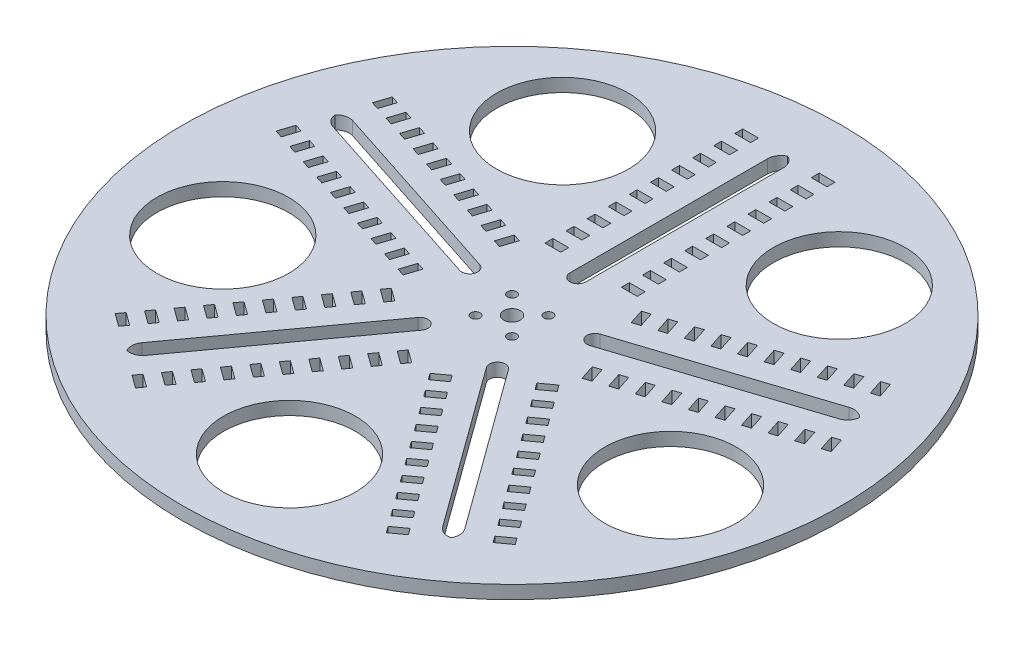
from build123d import *

# Parameters (mm, degrees)
CROQUIS1_R              = 125
SALIENTE_EXTRUIR1_DEPTH = 5
CROQUIS2_R              = 3.15
CORTAR_EXTRUIR1_DEPTH   = 177.847391838
CORTAR_EXTRUIR2_DEPTH   = 177.847391838
CROQUIS5_W              = 6
CROQUIS5_H              = 3
CORTAR_EXTRUIR3_DEPTH   = 177.847391838
CROQUIS7_R              = 25
CORTAR_EXTRUIR4_DEPTH   = 10
REDONDEO1_R             = 5
CORTAR_EXTRUIR5_DEPTH   = 177.847391838
CROQUIS9_W              = 6
CROQUIS9_H              = 3
CORTAR_EXTRUIR6_DEPTH   = 177.847391838


with BuildPart() as part:
    # Croquis1 → Saliente-Extruir1 (new body)
    with BuildSketch(Plane(origin=(0, 0, 0), x_dir=(1, 0, 0), z_dir=(0, 1, 0))):
        with Locations(Location((0, 0, 0), (0, 0, 270))):
            Circle(CROQUIS1_R)
    extrude(amount=SALIENTE_EXTRUIR1_DEPTH)

    # Croquis2 → Cortar-Extruir1 (cut, through all)
    with BuildSketch(Plane(origin=(0, 5, 0), x_dir=(1, 0, 0), z_dir=(0, 1, 0))):
        with Locations(Location((0, 0, 0), (0, 0, 270))):
            Circle(CROQUIS2_R)
    extrude(amount=-CORTAR_EXTRUIR1_DEPTH, mode=Mode.SUBTRACT)

    # Croquis3 → Cortar-Extruir2 (cut, through all)
    with BuildSketch(Plane(origin=(0, 5, 0), x_dir=(1, 0, 0), z_dir=(0, 1, 0))):
        with BuildLine():
            Line((3, 25), (3, 104.957134107))
            ThreePointArc((3, 104.957134107), (0, 105), (-3, 104.957134107))
            Line((-3, 104.957134107), (-3, 25))
            ThreePointArc((-3, 25), (0, 22), (3, 25))
        make_face()
        with BuildLine():
            ThreePointArc((100.747217307, 29.580368571), (99.860934211, 32.446784409), (98.893115341, 35.286707669))
            Line((98.893115341, 35.286707669), (22.849361924, 10.578594408))
            ThreePointArc((22.849361924, 10.578594408), (20.923243358, 6.798373876), (24.703463891, 4.87225531))
            Line((24.703463891, 4.87225531), (100.747217307, 29.580368571))
        make_face()
        with BuildLine():
            ThreePointArc((59.265204568, -86.675460931), (61.717451491, -84.946784409), (64.119306534, -83.148749417))
            Line((64.119306534, -83.148749417), (17.12168229, -18.462069102))
            ThreePointArc((17.12168229, -18.462069102), (12.93127555, -17.798373876), (12.267580324, -21.988780616))
            Line((12.267580324, -21.988780616), (59.265204568, -86.675460931))
        make_face()
        with BuildLine():
            Line((-17.12168229, -18.462069102), (-64.119306534, -83.148749417))
            ThreePointArc((-64.119306534, -83.148749417), (-61.717451491, -84.946784409), (-59.265204568, -86.675460931))
            Line((-59.265204568, -86.675460931), (-12.267580324, -21.988780616))
            ThreePointArc((-12.267580324, -21.988780616), (-12.93127555, -17.798373876), (-17.12168229, -18.462069102))
        make_face()
        with BuildLine():
            Line((-22.849361924, 10.578594408), (-98.893115341, 35.286707669))
            ThreePointArc((-98.893115341, 35.286707669), (-99.860934211, 32.446784409), (-100.747217307, 29.580368571))
            Line((-100.747217307, 29.580368571), (-24.703463891, 4.87225531))
            ThreePointArc((-24.703463891, 4.87225531), (-20.923243358, 6.798373876), (-22.849361924, 10.578594408))
        make_face()
    extrude(amount=-CORTAR_EXTRUIR2_DEPTH, mode=Mode.SUBTRACT)

    # Croquis5 → Cortar-Extruir3 (cut, through all)
    with BuildSketch(Plane(origin=(0, 5, 0), x_dir=(1, 0, 0), z_dir=(0, 1, 0))):
        Polygon((91.599967261, 48.163222461), (93.454069227, 42.456883364), (96.307238776, 43.383934347), (94.453136809, 49.090273445), align=None)
        with Locations((-14.5, 103.5)):
            Rectangle(CROQUIS5_W, CROQUIS5_H)
        with Locations((14.5, 103.5)):
            Rectangle(CROQUIS5_W, CROQUIS5_H)
        Polygon((100.561460097, 20.582583489), (102.415562064, 14.876244391), (105.268731613, 15.803295374), (103.414629646, 21.509634472), align=None)
        Polygon((74.111893135, -72.233491511), (69.257791169, -75.760203025), (71.021146926, -78.187254008), (75.875248892, -74.660542494), align=None)
        Polygon((50.650400299, -89.279263828), (45.796298332, -92.805975341), (47.559654089, -95.233026324), (52.413756055, -91.706314811), align=None)
        Polygon((-45.796298332, -92.805975341), (-50.650400298, -89.279263828), (-52.413756055, -91.706314811), (-47.559654089, -95.233026325), align=None)
        Polygon((-69.257791169, -75.760203025), (-74.111893135, -72.233491511), (-75.875248892, -74.660542494), (-71.021146926, -78.187254008), align=None)
        Polygon((-102.415562064, 14.876244391), (-100.561460097, 20.582583489), (-103.414629646, 21.509634472), (-105.268731613, 15.803295374), align=None)
        Polygon((-93.454069227, 42.456883364), (-91.599967261, 48.163222461), (-94.453136809, 49.090273445), (-96.307238776, 43.383934347), align=None)
    extrude(amount=-CORTAR_EXTRUIR3_DEPTH, mode=Mode.SUBTRACT)

    # Croquis7 → Cortar-Extruir4 (cut)
    with BuildSketch(Plane(origin=(0, 5, 0), x_dir=(1, 0, 0), z_dir=(0, 1, 0))):
        with Locations(Location((-50.946557671, 70.121920888, 0), (0, 0, 270))):
            Circle(CROQUIS7_R)
        with Locations(Location((52.237827472, 71.899201297, 0), (0, 0, 270))):
            Circle(CROQUIS7_R)
        with Locations(Location((85.813850149, -25.685770723, 0), (0, 0, 270))):
            Circle(CROQUIS7_R)
        with Locations(Location((3.380588228, -87.773880631, 0), (0, 0, 270))):
            Circle(CROQUIS7_R)
        with Locations(Location((-81.14199212, -28.561470832, 0), (0, 0, 270))):
            Circle(CROQUIS7_R)
    extrude(amount=-CORTAR_EXTRUIR4_DEPTH, mode=Mode.SUBTRACT)

    # Redondeo1
    # the kernel refuses this fillet: 5 mm, written as the material it adds along each edge
    with BuildSketch(Plane(origin=(-98.893115341, 5, -35.286707669), x_dir=(-0.31309131381965727, 0, 0.9497230276299932), z_dir=(0, -1, 0)), Plane(origin=(-64.119306534, 5, 83.148749417), x_dir=(0.8064897373416208, 0, 0.5912480896904814), z_dir=(0, -1, 0)), Plane(origin=(59.265204568, 5, 86.675460931), x_dir=(0.8115293830747445, 0, -0.5843116124178303), z_dir=(0, -1, 0)), Plane(origin=(100.747217307, 5, -29.580368571), x_dir=(-0.30493699573220334, 0, -0.9523725261859552), z_dir=(0, -1, 0)), Plane(origin=(3, 5, -104.957134107), x_dir=(-0.9999908108645211, 0, -0.004286978716716978), z_dir=(0, -1, 0))) as redondeo1_piece_1:
        with BuildLine():
            CenterArc((4.978617178, -4.998525266), REDONDEO1_R, 88.608381462, 91.145991998)
            Line((-0.021336877, -4.977090372), (0, 0))
            ThreePointArc((0, 0), (2.550023433, 0.030969422), (5.100046865, 0))
        make_face()
    extrude(amount=5)
    with BuildSketch(Plane(origin=(-100.747217307, 5, -29.580368571), x_dir=(0.9510565162951053, 0, 0.30901699437509594), z_dir=(0, -1, 0)), Plane(origin=(64.119306534, 5, 83.148749417), x_dir=(-0.5877852522923023, 0, -0.8090169943750716), z_dir=(0, -1, 0))) as redondeo1_piece_2:
        with BuildLine():
            CenterArc((4.977136108, -5), REDONDEO1_R, 90, 91.145991998)
            ThreePointArc((-0.021863792, -5.1), (-0.041901034, -2.549867235), (0, 0))
            Line((0, 0), (4.977136108, 0))
        make_face()
    extrude(amount=5)
    with BuildSketch(Plane(origin=(-59.265204568, 5, 86.675460931), x_dir=(-0.8115293830747364, 0, -0.5843116124178414), z_dir=(0, -1, 0)), Plane(origin=(98.893115341, 5, -35.286707669), x_dir=(0.3130913138196611, 0, 0.949723027629992), z_dir=(0, -1, 0)), Plane(origin=(-3, 5, -104.957134107), x_dir=(0.9999908108645212, 0, -0.004286978716706356), z_dir=(0, -1, 0))) as redondeo1_piece_3:
        with BuildLine():
            CenterArc((4.978617178, 4.998525266), REDONDEO1_R, 180.24562654, 91.145991998)
            Line((-0.021336877, 4.977090372), (0, 0))
            ThreePointArc((0, 0), (2.550023433, -0.030969422), (5.100046865, 0))
        make_face()
    extrude(amount=5)

    # Croquis8 → Cortar-Extruir5 (cut, through all)
    with BuildSketch(Plane(origin=(0, 5, 0), x_dir=(1, 0, 0), z_dir=(0, 1, 0))):
        with BuildLine():
            Line((-6.915, 5.165), (-6.915, 6.915))
            Line((-6.915, 6.915), (-5.165, 6.915))
            ThreePointArc((-5.165, 6.915), (-8.152436867, 8.152436867), (-6.915, 5.165))
        make_face()
        with BuildLine():
            Line((-5.165, 6.915), (-6.915, 6.915))
            Line((-6.915, 6.915), (-6.915, 5.165))
            ThreePointArc((-6.915, 5.165), (-5.677563133, 5.677563133), (-5.165, 6.915))
        make_face()
        with BuildLine():
            ThreePointArc((8.665, 6.915), (6.915, 8.665), (5.165, 6.915))
            Line((5.165, 6.915), (6.915, 6.915))
            Line((6.915, 6.915), (6.915, 5.165))
            ThreePointArc((6.915, 5.165), (8.152436867, 5.677563133), (8.665, 6.915))
        make_face()
        with BuildLine():
            Line((6.915, 6.915), (5.165, 6.915))
            ThreePointArc((5.165, 6.915), (5.677563133, 5.677563133), (6.915, 5.165))
            Line((6.915, 5.165), (6.915, 6.915))
        make_face()
        with BuildLine():
            ThreePointArc((8.665, -6.915), (8.152436867, -5.677563133), (6.915, -5.165))
            Line((6.915, -5.165), (6.915, -6.915))
            Line((6.915, -6.915), (5.165, -6.915))
            ThreePointArc((5.165, -6.915), (6.915, -8.665), (8.665, -6.915))
        make_face()
        with BuildLine():
            Line((6.915, -6.915), (6.915, -5.165))
            ThreePointArc((6.915, -5.165), (5.677563133, -5.677563133), (5.165, -6.915))
            Line((5.165, -6.915), (6.915, -6.915))
        make_face()
        with BuildLine():
            ThreePointArc((-5.165, -6.915), (-5.677563133, -5.677563133), (-6.915, -5.165))
            Line((-6.915, -5.165), (-6.915, -6.915))
            Line((-6.915, -6.915), (-5.165, -6.915))
        make_face()
        with BuildLine():
            Line((-6.915, -6.915), (-6.915, -5.165))
            ThreePointArc((-6.915, -5.165), (-8.152436867, -8.152436867), (-5.165, -6.915))
            Line((-5.165, -6.915), (-6.915, -6.915))
        make_face()
    extrude(amount=-CORTAR_EXTRUIR5_DEPTH, mode=Mode.SUBTRACT)

    # Croquis9 → Cortar-Extruir6 (cut, through all)
    with BuildSketch(Plane(origin=(0, 5, 0), x_dir=(1, 0, 0), z_dir=(0, 1, 0))):
        with Locations((-14.5, 95.5)):
            Rectangle(CROQUIS9_W, CROQUIS9_H)
        with Locations((14.5, 95.5)):
            Rectangle(CROQUIS9_W, CROQUIS9_H)
        with Locations((-14.5, 87.5)):
            Rectangle(CROQUIS9_W, CROQUIS9_H)
        with Locations((14.5, 87.5)):
            Rectangle(CROQUIS9_W, CROQUIS9_H)
        with Locations((-14.5, 79.5)):
            Rectangle(CROQUIS9_W, CROQUIS9_H)
        with Locations((14.5, 79.5)):
            Rectangle(CROQUIS9_W, CROQUIS9_H)
        with Locations((-14.5, 71.5)):
            Rectangle(CROQUIS9_W, CROQUIS9_H)
        with Locations((14.5, 71.5)):
            Rectangle(CROQUIS9_W, CROQUIS9_H)
        with Locations((-14.5, 63.5)):
            Rectangle(CROQUIS9_W, CROQUIS9_H)
        with Locations((14.5, 63.5)):
            Rectangle(CROQUIS9_W, CROQUIS9_H)
        with Locations((-14.5, 55.5)):
            Rectangle(CROQUIS9_W, CROQUIS9_H)
        with Locations((14.5, 55.5)):
            Rectangle(CROQUIS9_W, CROQUIS9_H)
        with Locations((-14.5, 47.5)):
            Rectangle(CROQUIS9_W, CROQUIS9_H)
        with Locations((14.5, 47.5)):
            Rectangle(CROQUIS9_W, CROQUIS9_H)
        with Locations((-14.5, 39.5)):
            Rectangle(CROQUIS9_W, CROQUIS9_H)
        with Locations((14.5, 39.5)):
            Rectangle(CROQUIS9_W, CROQUIS9_H)
        with Locations((-14.5, 31.5)):
            Rectangle(CROQUIS9_W, CROQUIS9_H)
        with Locations((14.5, 31.5)):
            Rectangle(CROQUIS9_W, CROQUIS9_H)
        Polygon((86.844684679, 46.61813749), (88.698786645, 40.911798392), (85.845617096, 39.984747409), (83.99151513, 45.691086506), align=None)
        Polygon((95.806177516, 19.037498517), (92.953007967, 18.110447534), (94.807109933, 12.404108436), (97.660279482, 13.331159419), align=None)
        Polygon((71.172966874, -68.188406539), (66.318864908, -71.715118053), (64.555509151, -69.28806707), (69.409611117, -65.761355556), align=None)
        Polygon((47.711474037, -85.234178856), (45.94811828, -82.807127873), (41.094016314, -86.333839386), (42.857372071, -88.760890369), align=None)
        Polygon((-42.857372071, -88.76089037), (-47.711474037, -85.234178856), (-45.94811828, -82.807127873), (-41.094016314, -86.333839386), align=None)
        Polygon((-66.318864908, -71.715118053), (-64.555509151, -69.28806707), (-69.409611117, -65.761355556), (-71.172966874, -68.188406539), align=None)
        Polygon((-97.660279482, 13.331159419), (-95.806177516, 19.037498517), (-92.953007967, 18.110447534), (-94.807109933, 12.404108436), align=None)
        Polygon((-88.698786645, 40.911798392), (-85.845617096, 39.984747409), (-83.99151513, 45.691086506), (-86.844684679, 46.61813749), align=None)
        Polygon((73.481882385, 35.967526482), (70.628712836, 35.040475499), (68.774610869, 40.746814596), (71.627780418, 41.67386558), align=None)
        Polygon((80.589273255, 14.093226607), (82.443375221, 8.386887509), (79.590205673, 7.459836526), (77.736103706, 13.166175624), align=None)
        Polygon((56.914300871, -58.770846143), (55.150945114, -56.34379516), (60.00504708, -52.817083646), (61.768402837, -55.244134629), align=None)
        Polygon((38.30691, -72.289906946), (33.452808034, -75.816618459), (31.689452277, -73.389567476), (36.543554244, -69.862855963), align=None)
        Polygon((-38.30691, -72.289906946), (-36.543554243, -69.862855963), (-31.689452277, -73.389567476), (-33.452808034, -75.816618459), align=None)
        Polygon((-56.914300871, -58.770846143), (-61.768402837, -55.244134629), (-60.00504708, -52.817083646), (-55.150945114, -56.34379516), align=None)
        Polygon((-80.589273255, 14.093226607), (-77.736103706, 13.166175624), (-79.590205673, 7.459836526), (-82.443375221, 8.386887509), align=None)
        Polygon((-73.481882385, 35.967526482), (-71.627780418, 41.67386558), (-68.774610869, 40.746814596), (-70.628712836, 35.040475499), align=None)
        Polygon((79.236232549, 44.146001535), (81.090334515, 38.439662437), (78.237164966, 37.512611454), (76.383063, 43.218950551), align=None)
        Polygon((88.197725386, 16.565362562), (85.344555837, 15.638311579), (87.198657803, 9.931972481), (90.051827352, 10.859023464), align=None)
        Polygon((66.470684856, -61.716270584), (61.616582889, -65.242982098), (59.853227132, -62.815931115), (64.707329099, -59.289219601), align=None)
        Polygon((43.009192019, -78.762042901), (41.245836262, -76.334991918), (36.391734296, -79.861703431), (38.155090052, -82.288754414), align=None)
        Polygon((-38.155090052, -82.288754414), (-43.009192019, -78.762042901), (-41.245836262, -76.334991918), (-36.391734296, -79.861703431), align=None)
        Polygon((-61.616582889, -65.242982098), (-59.853227132, -62.815931115), (-64.707329099, -59.289219601), (-66.470684856, -61.716270584), align=None)
        Polygon((-90.051827352, 10.859023464), (-88.197725386, 16.565362562), (-85.344555837, 15.638311579), (-87.198657803, 9.931972481), align=None)
        Polygon((-81.090334515, 38.439662437), (-78.237164966, 37.512611454), (-76.383063, 43.218950551), (-79.236232549, 44.146001535), align=None)
        Polygon((64.019328288, 39.201729625), (65.873430254, 33.495390527), (63.020260705, 32.568339544), (61.166158739, 38.274678641), align=None)
        Polygon((72.980821125, 11.621090652), (74.834923091, 5.914751554), (71.981753542, 4.987700571), (70.127651576, 10.694039669), align=None)
        Polygon((57.066120819, -48.771998674), (52.212018853, -52.298710188), (50.448663096, -49.871659205), (55.302765062, -46.344947691), align=None)
        Polygon((33.604627982, -65.817770991), (28.750526016, -69.344482504), (26.987170259, -66.917431521), (31.841272225, -63.390720008), align=None)
        Polygon((-28.750526016, -69.344482504), (-33.604627982, -65.817770991), (-31.841272225, -63.390720008), (-26.987170259, -66.917431521), align=None)
        Polygon((-52.212018853, -52.298710188), (-57.066120819, -48.771998674), (-55.302765062, -46.344947691), (-50.448663096, -49.871659205), align=None)
        Polygon((-74.834923091, 5.914751554), (-72.980821125, 11.621090652), (-70.127651576, 10.694039669), (-71.981753542, 4.987700571), align=None)
        Polygon((-65.873430254, 33.495390527), (-64.019328288, 39.201729625), (-61.166158739, 38.274678641), (-63.020260705, 32.568339544), align=None)
        Polygon((48.802424027, 34.257457715), (50.656525994, 28.551118617), (47.803356445, 27.624067634), (45.949254478, 33.330406731), align=None)
        Polygon((57.763916864, 6.676818742), (54.910747315, 5.749767759), (56.764849282, 0.043428661), (59.61801883, 0.970479644), align=None)
        Polygon((47.661556782, -35.827726764), (42.807454816, -39.354438278), (41.044099059, -36.927387295), (45.898201025, -33.400675781), align=None)
        Polygon((24.200063945, -52.873499081), (22.436708189, -50.446448098), (17.582606222, -53.973159611), (19.345961979, -56.400210594), align=None)
        Polygon((-19.345961979, -56.400210594), (-24.200063945, -52.873499081), (-22.436708188, -50.446448098), (-17.582606222, -53.973159611), align=None)
        Polygon((-42.807454816, -39.354438278), (-41.044099059, -36.927387295), (-45.898201025, -33.400675781), (-47.661556782, -35.827726764), align=None)
        Polygon((-59.61801883, 0.970479644), (-57.763916864, 6.676818742), (-54.910747315, 5.749767759), (-56.764849281, 0.043428661), align=None)
        Polygon((-50.656525994, 28.551118617), (-47.803356445, 27.624067634), (-45.949254478, 33.330406731), (-48.802424027, 34.257457715), align=None)
        Polygon((56.410876158, 36.72959367), (58.264978124, 31.023254572), (55.411808575, 30.096203589), (53.557706609, 35.802542686), align=None)
        Polygon((65.372368995, 9.148954697), (67.226470961, 3.442615599), (64.373301412, 2.515564616), (62.519199446, 8.221903714), align=None)
        Polygon((52.363838801, -42.299862719), (47.509736834, -45.826574233), (45.746381077, -43.39952325), (50.600483044, -39.872811736), align=None)
        Polygon((28.902345964, -59.345635036), (24.048243997, -62.872346549), (22.284888241, -60.445295566), (27.138990207, -56.918584053), align=None)
        Polygon((-24.048243997, -62.872346549), (-28.902345964, -59.345635036), (-27.138990207, -56.918584053), (-22.284888241, -60.445295566), align=None)
        Polygon((-47.509736834, -45.826574233), (-52.363838801, -42.299862719), (-50.600483044, -39.872811736), (-45.746381077, -43.39952325), align=None)
        Polygon((-67.226470961, 3.442615599), (-65.372368994, 9.148954697), (-62.519199446, 8.221903714), (-64.373301412, 2.515564616), align=None)
        Polygon((-58.264978124, 31.023254572), (-56.410876158, 36.72959367), (-53.557706609, 35.802542686), (-55.411808575, 30.096203589), align=None)
        Polygon((33.585519767, 29.313185805), (35.439621733, 23.606846707), (32.586452184, 22.679795724), (30.732350218, 28.386134821), align=None)
        Polygon((42.547012603, 1.732546832), (44.40111457, -3.973792266), (41.547945021, -4.900843249), (39.693843055, 0.805495849), align=None)
        Polygon((38.256992746, -22.883454854), (33.402890779, -26.410166368), (31.639535022, -23.983115385), (36.493636989, -20.456403871), align=None)
        Polygon((14.795499909, -39.929227171), (9.941397942, -43.455938684), (8.178042186, -41.028887701), (13.032144152, -37.502176188), align=None)
        Polygon((-9.941397942, -43.455938684), (-14.795499909, -39.929227171), (-13.032144152, -37.502176188), (-8.178042186, -41.028887701), align=None)
        Polygon((-33.402890779, -26.410166368), (-38.256992746, -22.883454854), (-36.493636989, -20.456403871), (-31.639535022, -23.983115385), align=None)
        Polygon((-44.40111457, -3.973792266), (-42.547012603, 1.732546832), (-39.693843055, 0.805495849), (-41.547945021, -4.900843249), align=None)
        Polygon((-35.439621733, 23.606846707), (-33.585519767, 29.313185805), (-30.732350218, 28.386134821), (-32.586452184, 22.679795724), align=None)
        Polygon((41.193971897, 31.78532176), (43.048073863, 26.078982662), (40.194904314, 25.151931679), (38.340802348, 30.858270776), align=None)
        Polygon((50.155464734, 4.204682787), (52.0095667, -1.501656311), (49.156397151, -2.428707294), (47.302295185, 3.277631804), align=None)
        Polygon((42.959274764, -29.355590809), (38.105172798, -32.882302323), (36.341817041, -30.45525134), (41.195919007, -26.928539826), align=None)
        Polygon((19.497781927, -46.401363126), (14.643679961, -49.928074639), (12.880324204, -47.501023656), (17.73442617, -43.974312143), align=None)
        Polygon((-14.643679961, -49.928074639), (-19.497781927, -46.401363126), (-17.73442617, -43.974312143), (-12.880324204, -47.501023656), align=None)
        Polygon((-38.105172798, -32.882302323), (-42.959274764, -29.355590809), (-41.195919007, -26.928539826), (-36.341817041, -30.45525134), align=None)
        Polygon((-52.0095667, -1.501656311), (-50.155464734, 4.204682787), (-47.302295185, 3.277631804), (-49.156397151, -2.428707294), align=None)
        Polygon((-43.048073863, 26.078982662), (-41.193971897, 31.78532176), (-38.340802348, 30.858270776), (-40.194904314, 25.151931679), align=None)
        Polygon((25.977067636, 26.84104985), (27.831169602, 21.134710752), (24.978000054, 20.207659769), (23.123898087, 25.913998866), align=None)
        Polygon((34.938560473, -0.739589123), (36.792662439, -6.445928221), (33.93949289, -7.372979204), (32.085390924, -1.666640106), align=None)
        Polygon((33.554710727, -16.411318899), (28.700608761, -19.938030413), (26.937253004, -17.51097943), (31.79135497, -13.984267916), align=None)
        Polygon((10.09321789, -33.457091216), (5.239115924, -36.983802729), (3.475760167, -34.556751746), (8.329862133, -31.030040233), align=None)
        Polygon((-5.239115924, -36.983802729), (-10.09321789, -33.457091216), (-8.329862133, -31.030040233), (-3.475760167, -34.556751746), align=None)
        Polygon((-28.700608761, -19.938030413), (-33.554710727, -16.411318899), (-31.79135497, -13.984267916), (-26.937253004, -17.51097943), align=None)
        Polygon((-36.792662439, -6.445928221), (-34.938560473, -0.739589123), (-32.085390924, -1.666640106), (-33.93949289, -7.372979204), align=None)
        Polygon((-27.831169602, 21.134710752), (-25.977067636, 26.84104985), (-23.123898087, 25.913998866), (-24.978000054, 20.207659769), align=None)
    extrude(amount=-CORTAR_EXTRUIR6_DEPTH, mode=Mode.SUBTRACT)


solid = part.part
